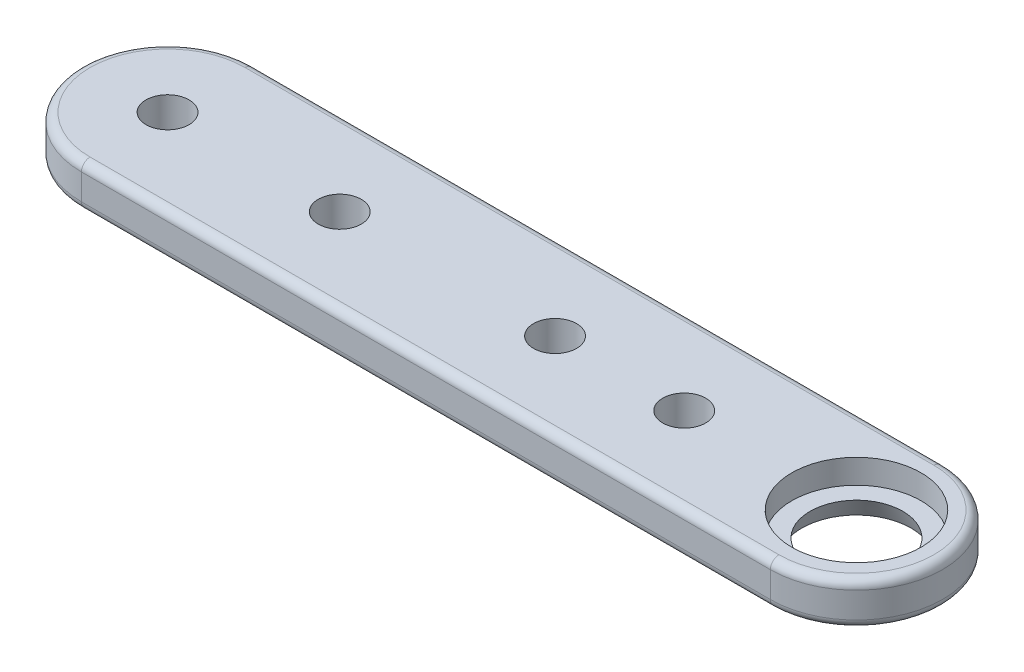
from build123d import *

# Parameters (mm, degrees)
SKETCH1_W           = 127
SKETCH1_H           = 25.4
BOSS_EXTRUDE1_DEPTH = 6.35
SKETCH2_R           = 3.175
SKETCH2_R_2         = 6.35
CUT_EXTRUDE1_DEPTH  = 66.068137364
SKETCH3_R           = 9.525
CUT_EXTRUDE2_DEPTH  = 3.571875
SKETCH4_R           = 3.175
CUT_EXTRUDE3_DEPTH  = 66.068137364
CUT_EXTRUDE4_DEPTH  = 66.068137364
FILLET1_R           = 1.27


with BuildPart() as part:
    # Sketch1 → Boss-Extrude1 (new body)
    with BuildSketch(Plane(origin=(0, 0, 0), x_dir=(1, 0, 0), z_dir=(0, 1, 0))):
        Rectangle(SKETCH1_W, SKETCH1_H)
    extrude(amount=BOSS_EXTRUDE1_DEPTH)

    # Sketch2 → Cut-Extrude1 (cut, through all)
    with BuildSketch(Plane(origin=(0, 6.35, 0), x_dir=(1, 0, 0), z_dir=(0, 1, 0))):
        with Locations((-50.8, 0)):
            Circle(SKETCH2_R)
        with Locations((50.8, 0)):
            Circle(SKETCH2_R_2)
        with Locations((-25.4, 0)):
            Circle(SKETCH2_R)
    extrude(amount=-CUT_EXTRUDE1_DEPTH, mode=Mode.SUBTRACT)

    # Sketch3 → Cut-Extrude2 (cut)
    with BuildSketch(Plane(origin=(0, 6.35, 0), x_dir=(1, 0, 0), z_dir=(0, 1, 0))):
        with Locations((50.8, 0)):
            Circle(SKETCH3_R)
    extrude(amount=-CUT_EXTRUDE2_DEPTH, mode=Mode.SUBTRACT)

    # Sketch4 → Cut-Extrude3 (cut, through all)
    with BuildSketch(Plane(origin=(0, 6.35, 0), x_dir=(1, 0, 0), z_dir=(0, 1, 0))):
        with Locations((25.4, 0)):
            Circle(SKETCH4_R)
        with Locations((6.35, 0)):
            Circle(SKETCH4_R)
    extrude(amount=-CUT_EXTRUDE3_DEPTH, mode=Mode.SUBTRACT)

    # Sketch5 → Cut-Extrude4 (cut, through all)
    with BuildSketch(Plane(origin=(0, 6.35, 0), x_dir=(1, 0, 0), z_dir=(0, 1, 0))):
        with BuildLine():
            ThreePointArc((-63.5, -1.5e-08), (-59.780256126, 8.980256116), (-50.8, 12.7))
            Line((-50.8, 12.7), (-63.5, 12.7))
            Line((-63.5, 12.7), (-63.5, -1.5e-08))
        make_face()
        with BuildLine():
            Line((-63.5, -12.7), (-50.8, -12.7))
            ThreePointArc((-50.8, -12.7), (-59.780256116, -8.980256126), (-63.5, -1.5e-08))
            Line((-63.5, -1.5e-08), (-63.5, -12.7))
        make_face()
        with BuildLine():
            Line((63.5, 12.7), (50.8, 12.7))
            ThreePointArc((50.8, 12.7), (59.780256121, 8.980256121), (63.5, 0))
            Line((63.5, 0), (63.5, 12.7))
        make_face()
        with BuildLine():
            ThreePointArc((63.5, 0), (59.780256125, -8.980256117), (50.800000011, -12.7))
            Line((50.800000011, -12.7), (63.5, -12.7))
            Line((63.5, -12.7), (63.5, 0))
        make_face()
    extrude(amount=-CUT_EXTRUDE4_DEPTH, mode=Mode.SUBTRACT)

    # Fillet1
    fillet1_edges = [part.edges().sort_by_distance(p)[0] for p in [
        (0, 0, -12.7),
        (0, 6.35, -12.7),
        (6e-09, 0, 12.7),
        (6e-09, 6.35, 12.7),
        (-63.5, 0, 0),
        (-63.5, 6.35, 0),
        (63.5, 0, -6e-09),
        (63.5, 6.35, -6e-09),
    ]]
    fillet(fillet1_edges, radius=FILLET1_R)

    # Sketch6 → Cut-Revolve2 (revolve, cut)
    with BuildSketch(Plane.ZY.offset(-50.8)):
        Polygon((-8.06821119, 0), (-6.35, 0), (-6.35, 2.778125), (-6.831310248, 2.778125), align=None)
    revolve(axis=Axis((50.8, 0, 0), (0, 1, 0)), mode=Mode.SUBTRACT)


solid = part.part
